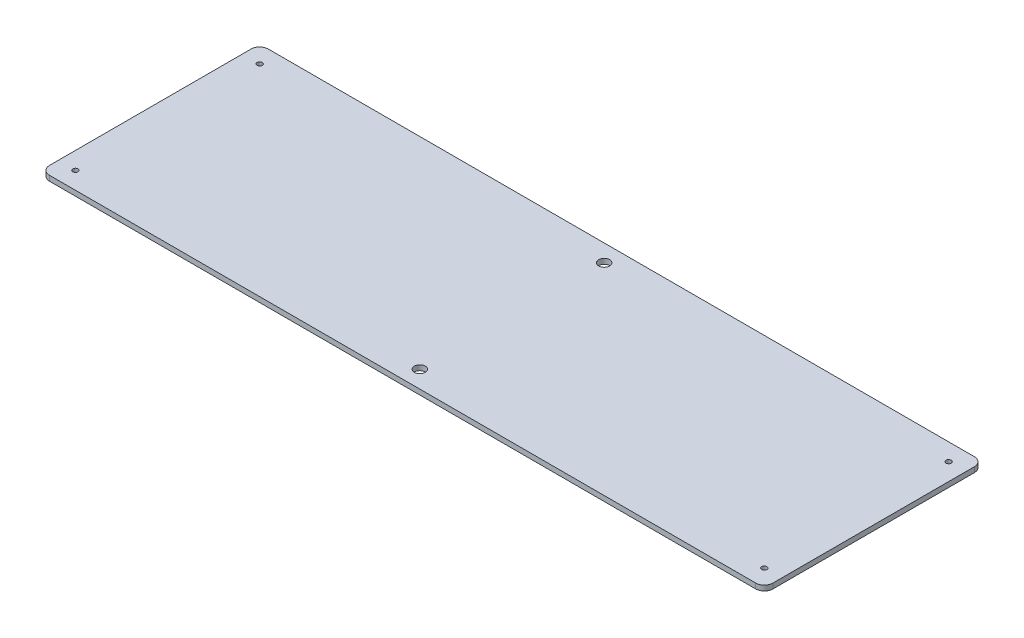
from build123d import *

# Parameters (mm, degrees)
SKETCH1_W           = 420
SKETCH1_H           = 127
BOSS_EXTRUDE1_DEPTH = 3
FILLET1_R           = 5
SKETCH2_R           = 1.5
CUT_EXTRUDE1_DEPTH  = 3
SKETCH4_R           = 3.175
CUT_EXTRUDE3_DEPTH  = 10


with BuildPart() as part:
    # Sketch1 → Boss-Extrude1 (new body)
    with BuildSketch(Plane(origin=(0, 0, 0), x_dir=(1, 0, 0), z_dir=(0, 1, 0))):
        Rectangle(SKETCH1_W, SKETCH1_H)
    extrude(amount=BOSS_EXTRUDE1_DEPTH)

    # Fillet1
    fillet1_edges = [part.edges().sort_by_distance(p)[0] for p in [
        (-210, 1.5, -63.5),
        (210, 1.5, -63.5),
        (210, 1.5, 63.5),
        (-210, 1.5, 63.5),
    ]]
    fillet(fillet1_edges, radius=FILLET1_R)

    # Sketch2 → Cut-Extrude1 (cut)
    with BuildSketch(Plane(origin=(0, 3, 0), x_dir=(1, 0, 0), z_dir=(0, 1, 0))):
        with Locations((200, -53.5)):
            Circle(SKETCH2_R)
        with Locations((-200, -53.5)):
            Circle(SKETCH2_R)
        with Locations((-200, 53.5)):
            Circle(SKETCH2_R)
        with Locations((200, 53.5)):
            Circle(SKETCH2_R)
    extrude(amount=-CUT_EXTRUDE1_DEPTH, mode=Mode.SUBTRACT)

    # Sketch4 → Cut-Extrude3 (cut)
    with BuildSketch(Plane(origin=(0, 3, 0), x_dir=(1, 0, 0), z_dir=(0, 1, 0))):
        with Locations((0, 53.5)):
            Circle(SKETCH4_R)
        with Locations((0, -53.5)):
            Circle(SKETCH4_R)
    extrude(amount=-CUT_EXTRUDE3_DEPTH, mode=Mode.SUBTRACT)


solid = part.part
